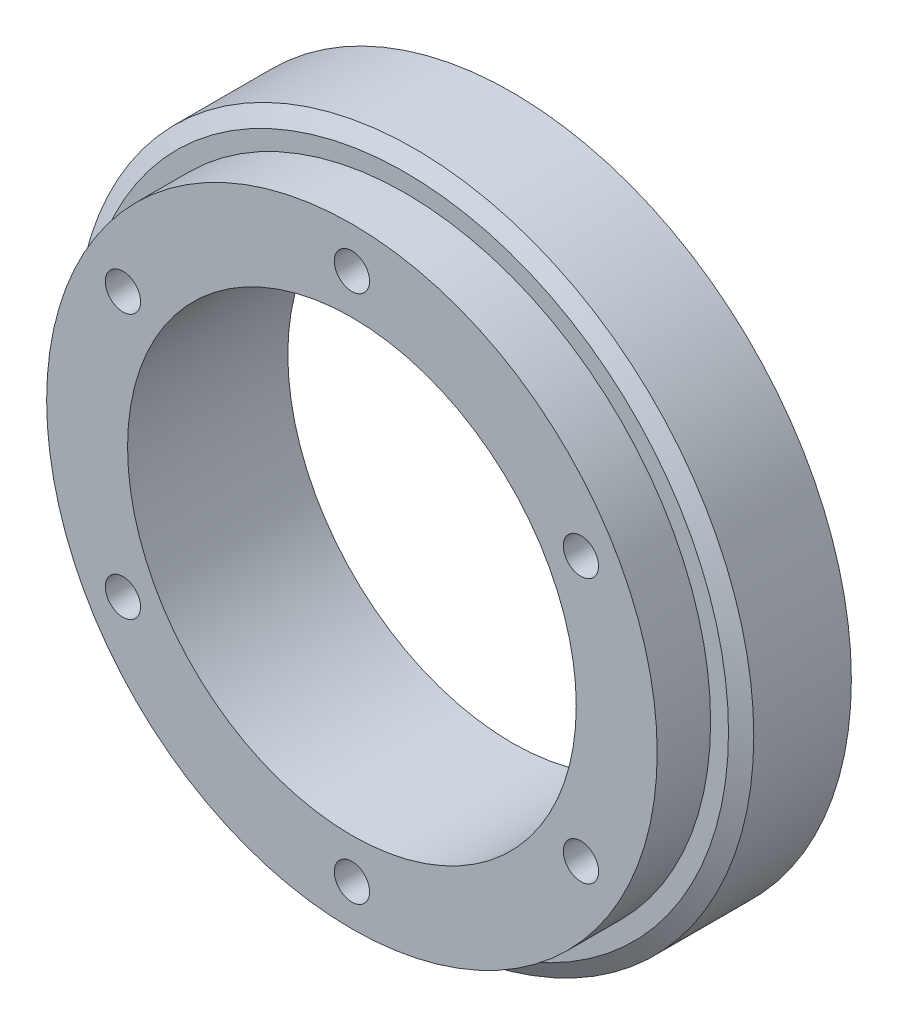
from build123d import *

# Parameters (mm, degrees)
M4X0_7_TAPPED_HOLE1_D = 3.3
CIRPATTERN1_COUNT     = 6


with BuildPart() as part:
    # Sketch1 → Revolve1 (revolve)
    with BuildSketch(Plane(origin=(0, 0, 0), x_dir=(0, 0, -1), z_dir=(1, 0, 0))):
        Polygon((0, 31.75), (-9.133974596, 31.75), (-10, 30.25), (-10, 28.575), (-15, 28.575), (-15, 21), (0, 21), align=None)
    revolve(axis=Axis((0, 0, 15), (0, 0, -1)))

    # M4x0.7 Tapped Hole1 (through all)
    with Locations(Plane(origin=(0, 0, 0), x_dir=(-1, 0, 0), z_dir=(0, 0, -1))):
        with Locations((0, 24.75)):
            m4x0_7_tapped_hole1 = Hole(M4X0_7_TAPPED_HOLE1_D / 2)

    # CirPattern1: M4x0.7 Tapped Hole1 ×6 about axis
    cirpattern1_axis = Axis((0, 0, 15), (0, 0, 1))
    for i in range(1, CIRPATTERN1_COUNT):
        add(m4x0_7_tapped_hole1.rotate(cirpattern1_axis, i * 360 / CIRPATTERN1_COUNT), mode=Mode.SUBTRACT)


solid = part.part
